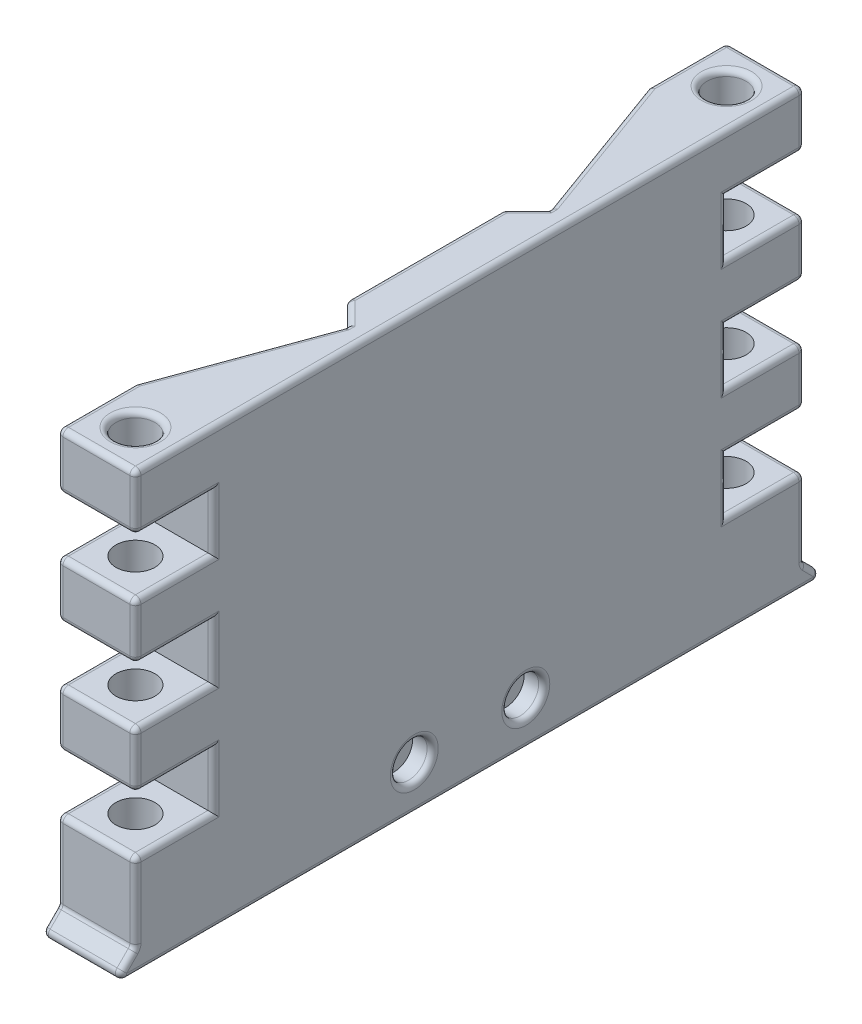
from build123d import *

# Parameters (mm, degrees)
SKETCH1_R               = 1.65
BOSS_EXTRUDE1_DEPTH     = 7
SKETCH1_3_R             = 1.65
BOSS_EXTRUDE2_DEPTH     = 5.2
CUT_EXTRUDE3_DEPTH      = 44.116122275
CUT_EXTRUDE3_DEPTH_BACK = 44.116122275
SKETCH7_R               = 1.75
CUT_EXTRUDE4_DEPTH      = 44.116122275
CUT_EXTRUDE4_DEPTH_BACK = 3
SKETCH7_3_R             = 1.75
CUT_EXTRUDE5_DEPTH      = 44.116122275
FILLET1_R               = 0.5


with BuildPart() as part:
    # Sketch1 → Boss-Extrude1 (new body)
    with BuildSketch(Plane(origin=(0, 0, 0), x_dir=(0, 0, -1), z_dir=(1, 0, 0))):
        Polygon((-17, -19.5), (-15, -19.5), (15, -19.5), (15, 19.5), (-8, 19.5), (-15, 19.5), (-15, 14.5), (-8, 14.5), (-8, 9.5), (-15, 9.5), (-15, 4.5), (-8, 4.5), (-8, -0.5), (-15, -0.5), (-15, -5.5), (-8, -5.5), (-8, -10.5), (-15, -10.5), (-15, -17.5), align=None)
        with Locations((10, -15.5)):
            Circle(SKETCH1_R, mode=Mode.SUBTRACT)
    extrude(amount=BOSS_EXTRUDE1_DEPTH)

    # Sketch1<3> → Boss-Extrude2 (add)
    with BuildSketch(Plane(origin=(0, 0, 0), x_dir=(0, 0, -1), z_dir=(1, 0, 0))):
        with Locations((10, -15.5)):
            Circle(SKETCH1_3_R)
    extrude(amount=BOSS_EXTRUDE2_DEPTH)

    # Sketch7 → Cut-Extrude3 (cut, two sides: drawn at the far end of the back side and taken through both)
    with BuildSketch(Plane.XZ.offset(19.5).offset(-CUT_EXTRUDE3_DEPTH_BACK)):
        with Locations((3.5, 11.5)):
            Circle(SKETCH7_R)
    extrude(amount=CUT_EXTRUDE3_DEPTH + CUT_EXTRUDE3_DEPTH_BACK, mode=Mode.SUBTRACT)

    # Sketch7<3> → Cut-Extrude4 (cut, two sides: drawn at the far end of the back side and taken through both)
    with BuildSketch(Plane.XZ.offset(19.5).offset(-CUT_EXTRUDE4_DEPTH_BACK)):
        Polygon((0.675, 13.13101451), (0.675, 9.86898549), (3.5, 8.237970979), (6.325, 9.86898549), (6.325, 13.13101451), (3.5, 14.762029021), align=None)
        with Locations((3.5, 11.5)):
            Circle(SKETCH7_3_R, mode=Mode.SUBTRACT)
    extrude(amount=CUT_EXTRUDE4_DEPTH + CUT_EXTRUDE4_DEPTH_BACK, mode=Mode.SUBTRACT)

    # Sketch8 → Cut-Extrude5 (cut, through all)
    with BuildSketch(Plane(origin=(0, 19.5, 0), x_dir=(1, 0, 0), z_dir=(0, 1, 0))):
        Polygon((0, -8), (5, 5.737387097), (5, 6), (3, 8), (3, 15), (0, 15), align=None)
    extrude(amount=-CUT_EXTRUDE5_DEPTH, mode=Mode.SUBTRACT)

    # Mirror2: part across plane


with BuildPart() as part_1:
    add(part.part)
    add(part.part.mirror(Plane(origin=(7, 0, -15), x_dir=(1, 0, 0), z_dir=(0, 0, 1))))

    # Fillet1
    fillet1_edges = [part_1.edges().sort_by_distance(p)[0] for p in [
        (2.5, -19.5, 1.131306451),
        (2.5, -19.5, -31.131306451),
        (0, -18.5, -46),
        (0, -18.5, 16),
        (3.5, -17.5, -45),
        (3.5, -10.5, -45),
        (0, -14, -45),
        (3.5, -5.5, -45),
        (3.5, -0.5, -45),
        (0, -3, -45),
        (3.5, 4.5, -45),
        (3.5, 9.5, -45),
        (0, 7, -45),
        (3.5, 14.5, -45),
        (0, 17, -45),
        (7, -10.5, 11.5),
        (7, -8, 8),
        (7, -5.5, 11.5),
        (7, -0.5, 11.5),
        (7, 2, 8),
        (7, 4.5, 11.5),
        (7, 9.5, 11.5),
        (7, 12, 8),
        (7, 14.5, 11.5),
        (7, 17, -45),
        (7, 14.5, -41.5),
        (7, 12, -38),
        (7, 9.5, -41.5),
        (7, 7, -45),
        (7, 4.5, -41.5),
        (7, 2, -38),
        (7, -0.5, -41.5),
        (7, -3, -45),
        (7, -5.5, -41.5),
        (7, -8, -38),
        (7, -10.5, -41.5),
        (7, -14, -45),
        (7, -18.5, -46),
        (7, -19.5, -15),
        (7, -18.5, 16),
        (3.5, -10.5, 15),
        (7, -14, 15),
        (3.5, -17.5, 15),
        (0, -14, 15),
        (3.5, -0.5, 15),
        (7, -3, 15),
        (3.5, -5.5, 15),
        (0, -3, 15),
        (3.5, 9.5, 15),
        (7, 7, 15),
        (3.5, 4.5, 15),
        (0, 7, 15),
        (7, 17, 15),
        (3.5, 14.5, 15),
        (0, 17, 15),
        (1.75, 19.5, -41.5),
        (1.75, 19.5, 11.5),
        (2.5, 19.5, -31.131306451),
        (0, 19.5, -41.5),
        (3.5, 19.5, -45),
        (7, 19.5, -15),
        (3.5, 19.5, 15),
        (0, 19.5, 11.5),
        (2.5, 19.5, 1.131306451),
        (0, -19.5, 12.5),
        (0, -19.5, -42.5),
        (0, 14.5, 11.5),
        (0, 9.5, 11.5),
        (0, 4.5, 11.5),
        (0, -0.5, 11.5),
        (0, -5.5, 11.5),
        (0, -10.5, 11.5),
        (0, -10.5, -41.5),
        (0, -5.5, -41.5),
        (0, -0.5, -41.5),
        (0, 4.5, -41.5),
        (0, 9.5, -41.5),
        (0, 14.5, -41.5),
        (3.5, -19.5, 17),
        (3.5, -19.5, -47),
        (7, -15.5, -21.65),
        (7, -15.5, -8.35),
        (5, 19.5, -5.868693549),
        (4, 19.5, -7),
        (3, 19.5, -15),
        (4, 19.5, -23),
        (5, 19.5, -24.131306451),
        (3, 0, -8),
        (3, -19.5, -15),
        (3, 0, -22),
        (5, -19.5, -24.131306451),
        (4, -19.5, -23),
        (4, -19.5, -7),
        (5, -19.5, -5.868693549),
    ]]
    fillet(fillet1_edges, radius=FILLET1_R)


solid = part_1.part
